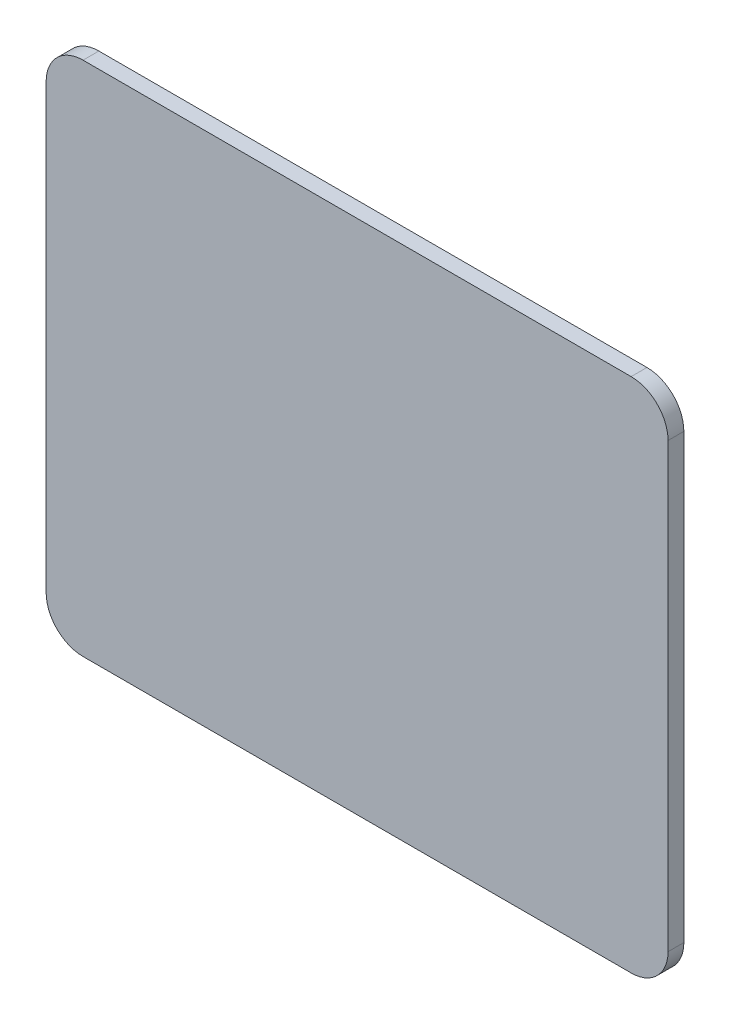
from build123d import *

# Parameters (mm, degrees)
BOSS_EXTRUDE1_DEPTH = 3


with BuildPart() as part:
    # Sketch1 → Boss-Extrude1 (new body)
    with BuildSketch(Plane.XY):
        with BuildLine():
            Line((-71.122052126, 155), (-71.122052126, 71))
            ThreePointArc((-71.122052126, 71), (-69.071799594, 66.050252532), (-64.122052126, 64))
            Line((-64.122052126, 64), (39.877947874, 64))
            ThreePointArc((39.877947874, 64), (44.827695342, 66.050252532), (46.877947874, 71))
            Line((46.877947874, 71), (46.877947874, 155))
            ThreePointArc((46.877947874, 155), (44.827695342, 159.949747468), (39.877947874, 162))
            Line((39.877947874, 162), (-64.122052126, 162))
            ThreePointArc((-64.122052126, 162), (-69.071799594, 159.949747468), (-71.122052126, 155))
        make_face()
    extrude(amount=-BOSS_EXTRUDE1_DEPTH)


solid = part.part
